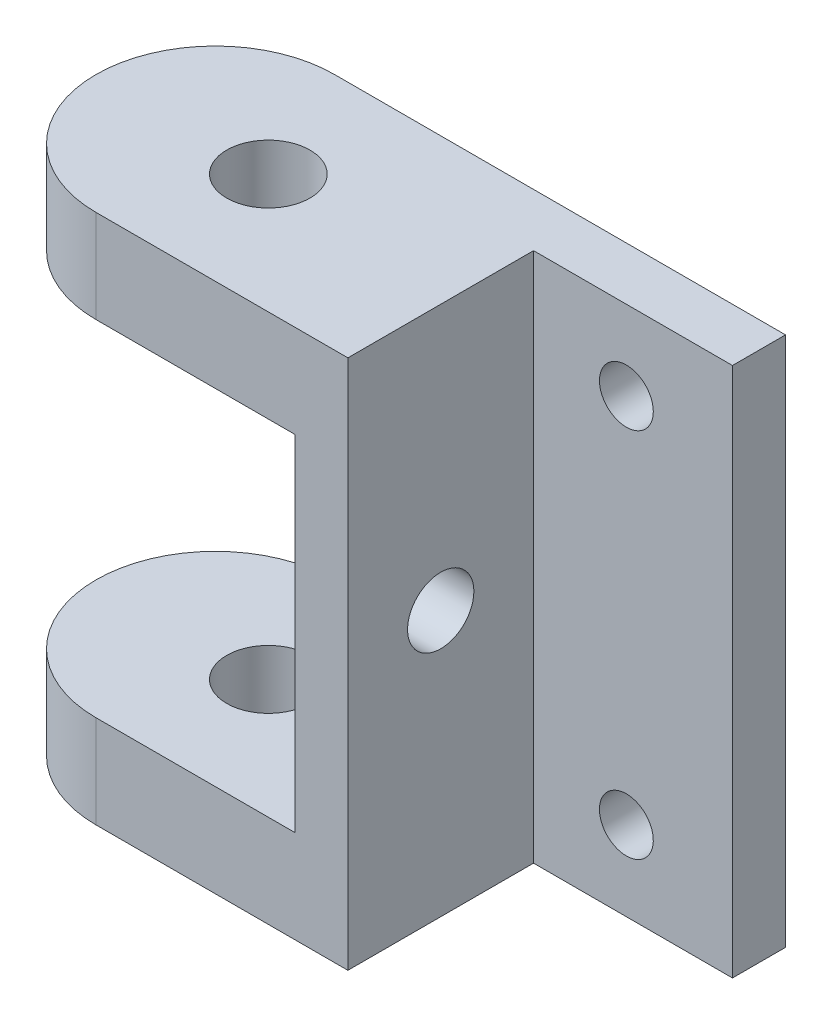
from build123d import *

# Parameters (mm, degrees)
CROQUIS1_W              = 1.4
CROQUIS1_H              = 2.6
SALIENTE_EXTRUIR1_DEPTH = 0.4
CROQUIS1_3_W            = 0.4
CROQUIS1_3_H            = 2.6
SALIENTE_EXTRUIR2_DEPTH = 1.9
CROQUIS1_6_W            = 0.4
CROQUIS1_6_H            = 0.7
SALIENTE_EXTRUIR3_DEPTH = 1.9
CROQUIS1_8_W            = 1.4
CROQUIS1_8_H            = 0.7
SALIENTE_EXTRUIR5_DEPTH = 0.4
CROQUIS1_9_W            = 1.4
CROQUIS1_9_H            = 0.7
SALIENTE_EXTRUIR6_DEPTH = 0.4
CROQUIS1_10_W           = 0.4
CROQUIS1_10_H           = 0.7
SALIENTE_EXTRUIR7_DEPTH = 1.9
CROQUIS1_11_W           = 0.4
CROQUIS1_11_H           = 0.7
CROQUIS1_11_W_2         = 1.4
SALIENTE_EXTRUIR8_DEPTH = 2.4
CROQUIS2_R              = 0.203
CORTAR_EXTRUIR1_DEPTH   = 2.4
CROQUIS3_R              = 0.25
CORTAR_EXTRUIR2_DEPTH   = 2.4
CROQUIS4_R              = 0.314
CORTAR_EXTRUIR3_DEPTH   = 10
REDONDEO3_R             = 0.9
REDONDEO4_R             = 0.9


with BuildPart() as part:
    # Croquis1 → Saliente-Extruir1 (new body)
    with BuildSketch(Plane(origin=(0, 0, 0), x_dir=(0, 0, -1), z_dir=(1, 0, 0))):
        with Locations((-0.2, 0)):
            Rectangle(CROQUIS1_W, CROQUIS1_H)
    extrude(amount=SALIENTE_EXTRUIR1_DEPTH)

    # Croquis1<3> → Saliente-Extruir2 (add)
    with BuildSketch(Plane(origin=(0, 0, 0), x_dir=(0, 0, -1), z_dir=(1, 0, 0))):
        with Locations((0.7, 0)):
            Rectangle(CROQUIS1_3_W, CROQUIS1_3_H)
    extrude(amount=SALIENTE_EXTRUIR2_DEPTH)

    # Croquis1<6> → Saliente-Extruir3 (add)
    with BuildSketch(Plane(origin=(0, 0, 0), x_dir=(0, 0, -1), z_dir=(1, 0, 0))):
        with Locations((0.7, 1.65)):
            Rectangle(CROQUIS1_6_W, CROQUIS1_6_H)
    extrude(amount=SALIENTE_EXTRUIR3_DEPTH)

    # Croquis1<8> → Saliente-Extruir5 (add)
    with BuildSketch(Plane(origin=(0, 0, 0), x_dir=(0, 0, -1), z_dir=(1, 0, 0))):
        with Locations((-0.2, 1.65)):
            Rectangle(CROQUIS1_8_W, CROQUIS1_8_H)
    extrude(amount=SALIENTE_EXTRUIR5_DEPTH)

    # Croquis1<9> → Saliente-Extruir6 (add)
    with BuildSketch(Plane(origin=(0, 0, 0), x_dir=(0, 0, -1), z_dir=(1, 0, 0))):
        with Locations((-0.2, -1.65)):
            Rectangle(CROQUIS1_9_W, CROQUIS1_9_H)
    extrude(amount=SALIENTE_EXTRUIR6_DEPTH)

    # Croquis1<10> → Saliente-Extruir7 (add)
    with BuildSketch(Plane(origin=(0, 0, 0), x_dir=(0, 0, -1), z_dir=(1, 0, 0))):
        with Locations((0.7, -1.65)):
            Rectangle(CROQUIS1_10_W, CROQUIS1_10_H)
    extrude(amount=SALIENTE_EXTRUIR7_DEPTH)

    # Croquis1<11> → Saliente-Extruir8 (add)
    with BuildSketch(Plane(origin=(0, 0, 0), x_dir=(0, 0, -1), z_dir=(1, 0, 0))):
        with Locations((0.7, 1.65)):
            Rectangle(CROQUIS1_11_W, CROQUIS1_11_H)
        with Locations((-0.2, 1.65)):
            Rectangle(CROQUIS1_11_W_2, CROQUIS1_11_H)
        with Locations((-0.2, -1.65)):
            Rectangle(CROQUIS1_11_W_2, CROQUIS1_11_H)
        with Locations((0.7, -1.65)):
            Rectangle(CROQUIS1_11_W, CROQUIS1_11_H)
    extrude(amount=-SALIENTE_EXTRUIR8_DEPTH)

    # Croquis2 → Cortar-Extruir1 (cut)
    with BuildSketch(Plane.XY.offset(-0.5)):
        with Locations((1.1, 1.4)):
            Circle(CROQUIS2_R)
        with Locations(Location((1.1, -1.4, 0), (0, 0, 90))):
            Circle(CROQUIS2_R)
    extrude(amount=-CORTAR_EXTRUIR1_DEPTH, mode=Mode.SUBTRACT)

    # Croquis3 → Cortar-Extruir2 (cut)
    with BuildSketch(Plane(origin=(0.4, 0, 0), x_dir=(0, 0, -1), z_dir=(1, 0, 0))):
        with Locations((-0.2, 0)):
            Circle(CROQUIS3_R)
    extrude(amount=-CORTAR_EXTRUIR2_DEPTH, mode=Mode.SUBTRACT)

    # Croquis4 → Cortar-Extruir3 (cut)
    with BuildSketch(Plane.XZ.offset(2)):
        with Locations(Location((-1.1, 0, 0), (0, 0, 270))):
            Circle(CROQUIS4_R)
    extrude(amount=-CORTAR_EXTRUIR3_DEPTH, mode=Mode.SUBTRACT)

    # Redondeo3
    redondeo3_edges = [part.edges().sort_by_distance(p)[0] for p in [
        (-2.4, 1.65, 0.9),
        (-2.4, -1.65, 0.9),
    ]]
    fillet(redondeo3_edges, radius=REDONDEO3_R)

    # Redondeo4
    redondeo4_edges = [part.edges().sort_by_distance(p)[0] for p in [
        (-2.4, -1.65, -0.9),
        (-2.4, 1.65, -0.9),
    ]]
    fillet(redondeo4_edges, radius=REDONDEO4_R - 0.0001)  # a hair under: the kernel refuses the full size


solid = part.part
